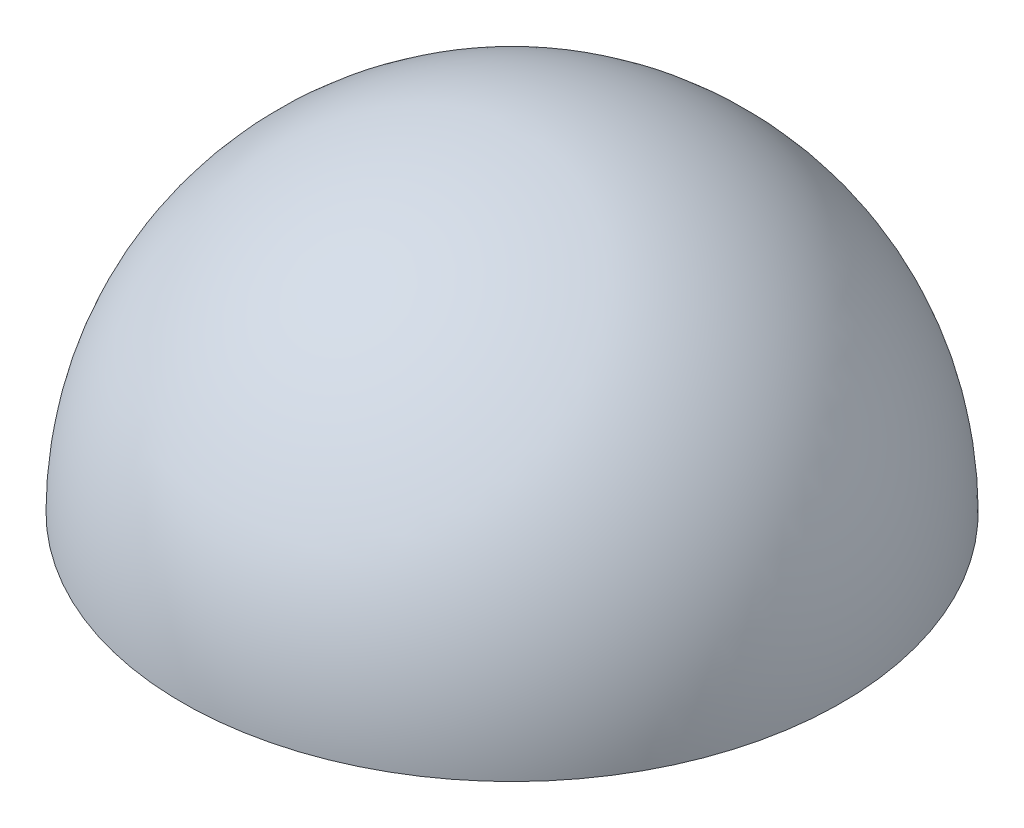
from build123d import *

# Parameters (mm, degrees)
SKETCH2_R           = 2.25
BOSS_EXTRUDE1_DEPTH = 0.1
DOME1_FACE_RADIUS   = 2.25
DOME1_HEIGHT        = 2.25
SKETCH4_R           = 2.25
CUT_EXTRUDE1_DEPTH  = 0.1


# Read off the part's stored shape, not the designer's step: Shell1
with BuildPart() as part:
    # Sketch2 → Boss-Extrude1 (new body)
    with BuildSketch(Plane(origin=(0, 0, 0), x_dir=(1, 0, 0), z_dir=(0, 1, 0))):
        with Locations(Location((0, 0, 0), (0, 0, 270))):
            Circle(SKETCH2_R)
    extrude(amount=BOSS_EXTRUDE1_DEPTH)

    # Dome1: a dome of height H over a round flat face of radius A is a cap of a sphere of radius (A * A + H * H) / (2 * H)
    dome1_r = (DOME1_FACE_RADIUS * DOME1_FACE_RADIUS + DOME1_HEIGHT * DOME1_HEIGHT) / (2 * DOME1_HEIGHT)
    dome1_base = Plane((0, 0.1, 0), z_dir=(0, 1, 0))
    with Locations(dome1_base.offset(DOME1_HEIGHT - dome1_r)):
        dome1_ball = Sphere(dome1_r, mode=Mode.PRIVATE)
    add(split(dome1_ball, bisect_by=dome1_base, keep=Keep.TOP, mode=Mode.PRIVATE))

    # Sketch4 → Cut-Extrude1 (cut)
    with BuildSketch(Plane.XZ):
        Circle(SKETCH4_R)
    extrude(amount=-CUT_EXTRUDE1_DEPTH, mode=Mode.SUBTRACT)

    # Shell1 outline → Shell1 (revolve, cut)
    with BuildSketch(Plane.XY):
        with BuildLine():
            Line((0, 0.1), (2.15, 0.099999998))
            ThreePointArc((2.15, 0.099999998), (1.52027958, 1.620279579), (0, 2.25))
            Line((0, 2.25), (0, 0.1))
        make_face()
    revolve(axis=Axis((0, 0, 0), (0, 1, 0)), mode=Mode.SUBTRACT)


solid = part.part
